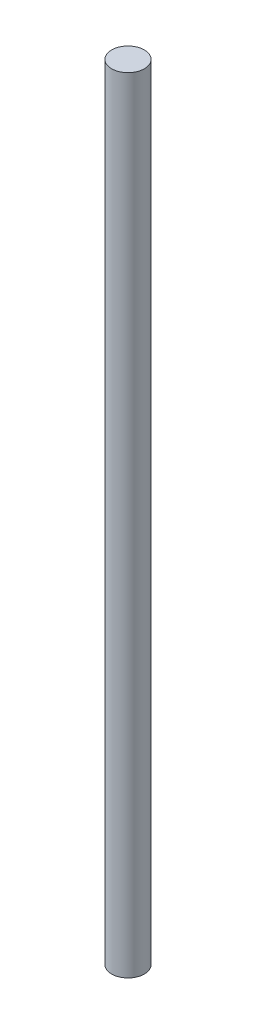
from build123d import *

# Parameters (mm, degrees)
SKETCH1_R           = 6.35
BOSS_EXTRUDE1_DEPTH = 152.4


with BuildPart() as part:
    # Sketch1 → Boss-Extrude1 (new, symmetric)
    with BuildSketch(Plane(origin=(0, 0, 0), x_dir=(1, 0, 0), z_dir=(0, 1, 0))):
        Circle(SKETCH1_R)
    extrude(amount=BOSS_EXTRUDE1_DEPTH, both=True)


solid = part.part
